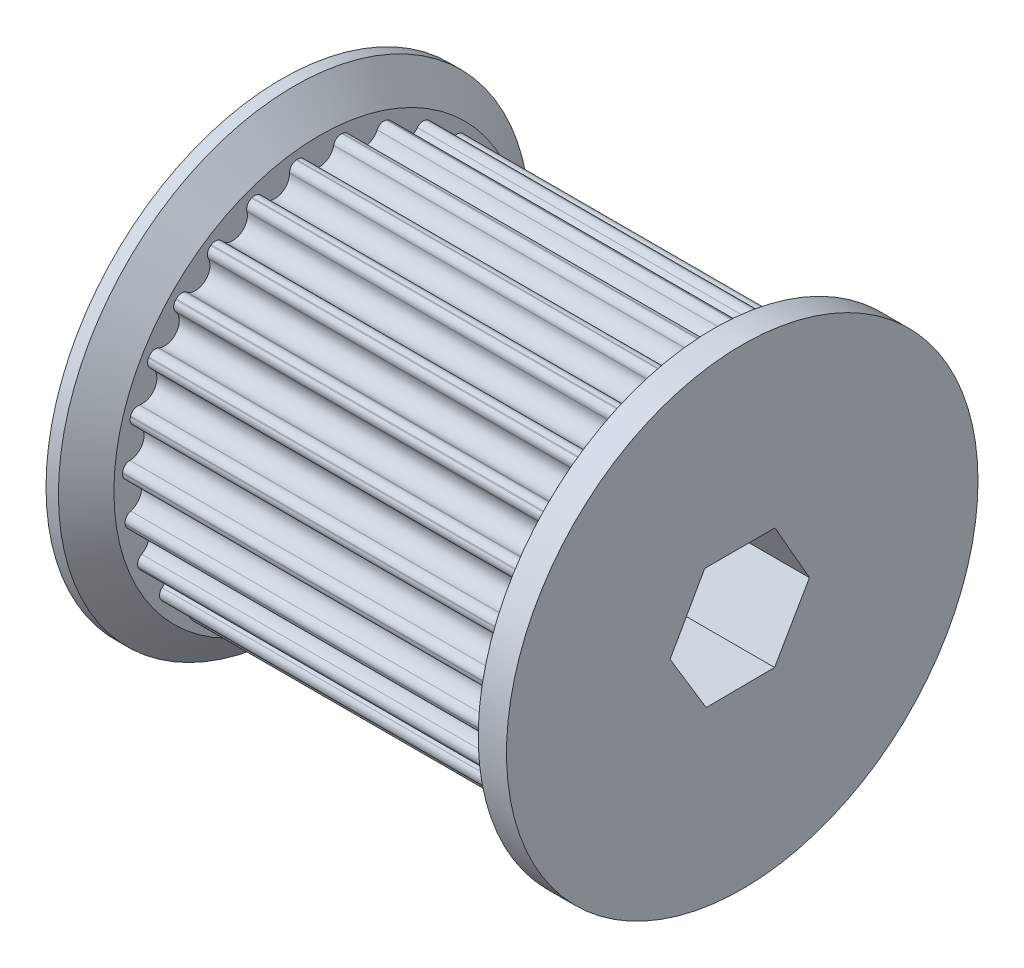
from build123d import *

# Parameters (mm, degrees)
SKETCH1_R                = 20.915
BOSS_EXTRUDE1_DEPTH      = 41.8338
CUT_EXTRUDE6_START       = -43
CUT_EXTRUDE6_DEPTH       = 43
FILLET4_R                = 0.8
CIRPATTERN1_COUNT        = 27
FILLET4_OF_CIRPATTERN1_R = 0.8
SKETCH10_R               = 25
BOSS_EXTRUDE7_DEPTH      = 3
BOSS_EXTRUDE8_START      = 4
SKETCH11_R               = 25
BOSS_EXTRUDE8_DEPTH      = 4
CHAMFER1_SIZE            = 3.2
CHAMFER1_SIZE2           = 2.68511882
CUT_EXTRUDE5_DEPTH       = 58.097019471
CUT_EXTRUDE5_DEPTH_BACK  = 58.097019471


with BuildPart() as part:
    # Sketch1 → Boss-Extrude1 (new body)
    with BuildSketch(Plane(origin=(0, 0, 0), x_dir=(0, 0, -1), z_dir=(1, 0, 0))):
        Circle(SKETCH1_R)
    extrude(amount=BOSS_EXTRUDE1_DEPTH)

    # Sketch8 → Cut-Extrude6 (cut)
    with BuildSketch(Plane(origin=(41.8338, 0, 0), x_dir=(0, 0, -1), z_dir=(1, 0, 0)).offset(CUT_EXTRUDE6_START)):
        with BuildLine():
            ThreePointArc((-1.488261256, 20.861982251), (0, 18.915), (1.488261256, 20.861982251))
            ThreePointArc((1.488261256, 20.861982251), (0, 20.915), (-1.488261256, 20.861982251))
        make_face()
    cut_extrude6 = extrude(amount=CUT_EXTRUDE6_DEPTH, mode=Mode.SUBTRACT)

    # Fillet4
    fillet4_edges = [part.edges().sort_by_distance(p)[0] for p in [
        (20.9169, 20.861982251, -1.488261256),
        (20.9169, 20.861982251, 1.488261256),
    ]]
    fillet(fillet4_edges, radius=FILLET4_R)

    # CirPattern1: Cut-Extrude6 ×27 about axis
    cirpattern1_axis = Axis((41.8338, 0, 0), (-1, 0, 0))
    for i in range(1, CIRPATTERN1_COUNT):
        add(cut_extrude6.rotate(cirpattern1_axis, i * 360 / CIRPATTERN1_COUNT), mode=Mode.SUBTRACT)

    # Fillet4 of CirPattern1
    fillet4_of_cirpattern1_edges = [part.edges().sort_by_distance(p)[0] for p in [
        (20.9169, 19.956428154, -6.259249183),
        (20.9169, 20.642861485, -3.362959221),
        (20.9169, 17.97501785, -10.692799367),
        (20.9169, 19.310878713, -8.032881696),
        (20.9169, 15.02456968, -14.549897969),
        (20.9169, 16.937841471, -12.269749439),
        (20.9169, 11.264143071, -17.622607806),
        (20.9169, 13.651680811, -15.845151815),
        (20.9169, 6.896463593, -19.745278294),
        (20.9169, 9.629554505, -18.566337954),
        (20.9169, 2.156993977, -20.803475719),
        (20.9169, 5.088296424, -20.286608009),
        (20.9169, -2.698759742, -20.740152383),
        (20.9169, 0.272726965, -20.913221775),
        (20.9169, -7.409022625, -19.558722063),
        (20.9169, -4.557545276, -20.412398342),
        (20.9169, -11.719863181, -17.322875975),
        (20.9169, -9.14211907, -18.81113723),
        (20.9169, -15.398882878, -14.153149158),
        (20.9169, -13.23383886, -16.195762842),
        (20.9169, -18.247744814, -10.220422408),
        (20.9169, -16.612118971, -12.707270687),
        (20.9169, -20.112866104, -5.73671004),
        (20.9169, -19.094835448, -8.533726279),
        (20.9169, -20.893697576, -0.943730148),
        (20.9169, -20.548144404, -3.90012648),
        (20.9169, -20.548144404, 3.90012648),
        (20.9169, -20.893697576, 0.943730148),
        (20.9169, -19.094835448, 8.533726279),
        (20.9169, -20.112866104, 5.73671004),
        (20.9169, -16.612118971, 12.707270687),
        (20.9169, -18.247744814, 10.220422408),
        (20.9169, -13.23383886, 16.195762842),
        (20.9169, -15.398882878, 14.153149158),
        (20.9169, -9.14211907, 18.81113723),
        (20.9169, -11.719863181, 17.322875975),
        (20.9169, -4.557545276, 20.412398342),
        (20.9169, -7.409022625, 19.558722063),
        (20.9169, 0.272726965, 20.913221775),
        (20.9169, -2.698759742, 20.740152383),
        (20.9169, 5.088296424, 20.286608009),
        (20.9169, 2.156993977, 20.803475719),
        (20.9169, 9.629554505, 18.566337954),
        (20.9169, 6.896463593, 19.745278294),
        (20.9169, 13.651680811, 15.845151815),
        (20.9169, 11.264143071, 17.622607806),
        (20.9169, 16.937841471, 12.269749439),
        (20.9169, 15.02456968, 14.549897969),
        (20.9169, 19.310878713, 8.032881696),
        (20.9169, 17.97501785, 10.692799367),
        (20.9169, 20.642861485, 3.362959221),
        (20.9169, 19.956428154, 6.259249183),
    ]]
    fillet(fillet4_of_cirpattern1_edges, radius=FILLET4_OF_CIRPATTERN1_R)

    # Sketch10 → Boss-Extrude7 (add)
    with BuildSketch(Plane(origin=(41.8338, 0, 0), x_dir=(0, 0, -1), z_dir=(1, 0, 0))):
        Circle(SKETCH10_R)
    extrude(amount=BOSS_EXTRUDE7_DEPTH)

    # Sketch11 → Boss-Extrude8 (add)
    with BuildSketch(Plane.ZY.offset(BOSS_EXTRUDE8_START)):
        Circle(SKETCH11_R)
    extrude(amount=-BOSS_EXTRUDE8_DEPTH)

    # Chamfer1
    chamfer1_edges = [part.edges().sort_by_distance(p)[0] for p in [
        (0, 0, -25),
    ]]
    chamfer1_side = [part.faces().sort_by_distance(p)[0] for p in [
        (0, 0, -24.292893216),
    ]]
    chamfer(chamfer1_edges, length=CHAMFER1_SIZE, length2=CHAMFER1_SIZE2, reference=chamfer1_side[0])

    # Sketch9 → Cut-Extrude5 (cut, two sides: drawn at the far end of the back side and taken through both)
    with BuildSketch(Plane.ZY.offset(-CUT_EXTRUDE5_DEPTH_BACK)):
        Polygon((-3.471061286, 6.444457654), (-7.125456531, 0.043657654), (-3.429837967, -6.357142346), (3.826782025, -6.409720657), (7.655941161, -0.063516257), (3.981752634, 6.444457654), align=None)
    extrude(amount=CUT_EXTRUDE5_DEPTH + CUT_EXTRUDE5_DEPTH_BACK, mode=Mode.SUBTRACT)


solid = part.part
